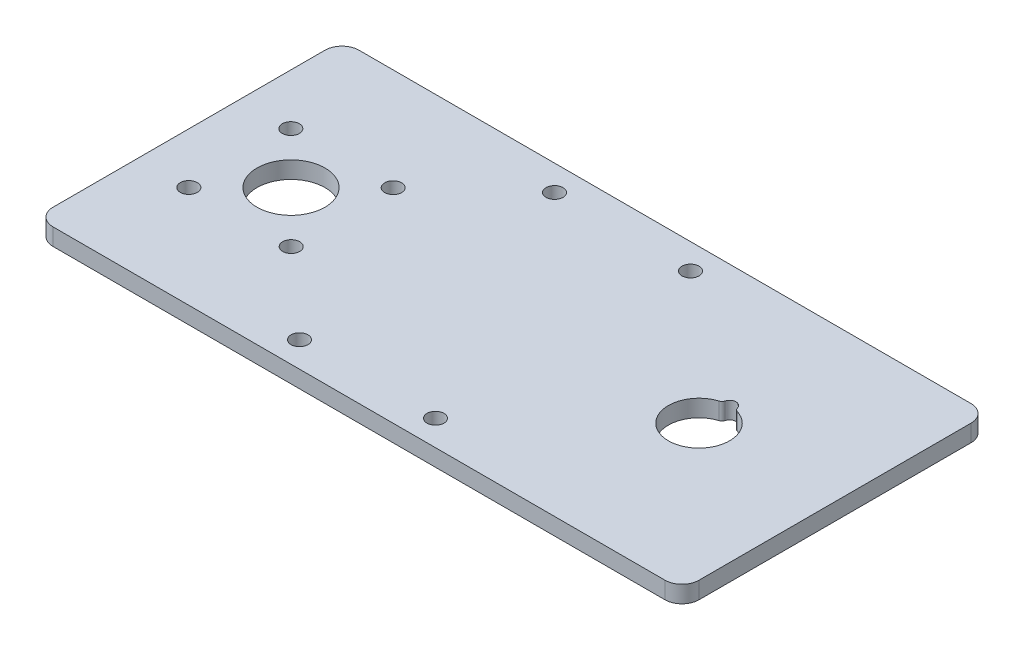
from build123d import *

# Parameters (mm, degrees)
SKETCH1_W           = 241.3
SKETCH1_H           = 114.3
SKETCH1_R           = 12.7
SKETCH1_R_2         = 3.175
BOSS_EXTRUDE1_DEPTH = 6.35
FILLET1_R           = 6.35
FILLET2_R           = 1.5875


with BuildPart() as part:
    # Sketch1 → Boss-Extrude1 (new body)
    with BuildSketch(Plane(origin=(0, 0, 0), x_dir=(1, 0, 0), z_dir=(0, 1, 0))):
        with Locations((120.65, 57.15)):
            Rectangle(SKETCH1_W, SKETCH1_H)
        with Locations((38.1, 57.15)):
            Circle(SKETCH1_R, mode=Mode.SUBTRACT)
        with Locations((88.9, 104.775)):
            Circle(SKETCH1_R_2, mode=Mode.SUBTRACT)
        with Locations((139.7, 104.775)):
            Circle(SKETCH1_R_2, mode=Mode.SUBTRACT)
        with Locations((139.7, 9.525)):
            Circle(SKETCH1_R_2, mode=Mode.SUBTRACT)
        with Locations((88.9, 9.525)):
            Circle(SKETCH1_R_2, mode=Mode.SUBTRACT)
        with Locations((18.983968606, 76.2)):
            Circle(SKETCH1_R_2, mode=Mode.SUBTRACT)
        with Locations((18.983968606, 38.1)):
            Circle(SKETCH1_R_2, mode=Mode.SUBTRACT)
        with Locations((57.216031394, 38.1)):
            Circle(SKETCH1_R_2, mode=Mode.SUBTRACT)
        with Locations((57.216031394, 76.2)):
            Circle(SKETCH1_R_2, mode=Mode.SUBTRACT)
        with BuildLine():
            ThreePointArc((188.131704345, 68.331953125), (190.5, 45.72), (192.868295655, 68.331953125))
            ThreePointArc((192.868295655, 68.331953125), (190.5, 70.96125), (188.131704345, 68.331953125))
        make_face(mode=Mode.SUBTRACT)
    extrude(amount=BOSS_EXTRUDE1_DEPTH)

    # Fillet1
    fillet1_edges = [part.edges().sort_by_distance(p)[0] for p in [
        (0, 3.175, -114.3),
        (241.3, 3.175, -114.3),
        (241.3, 3.175, 0),
        (0, 3.175, 0),
    ]]
    fillet(fillet1_edges, radius=FILLET1_R)

    # Fillet2
    fillet2_edges = [part.edges().sort_by_distance(p)[0] for p in [
        (188.131704345, 3.175, -68.331953125),
        (192.868295655, 3.175, -68.331953125),
    ]]
    fillet(fillet2_edges, radius=FILLET2_R)


solid = part.part
